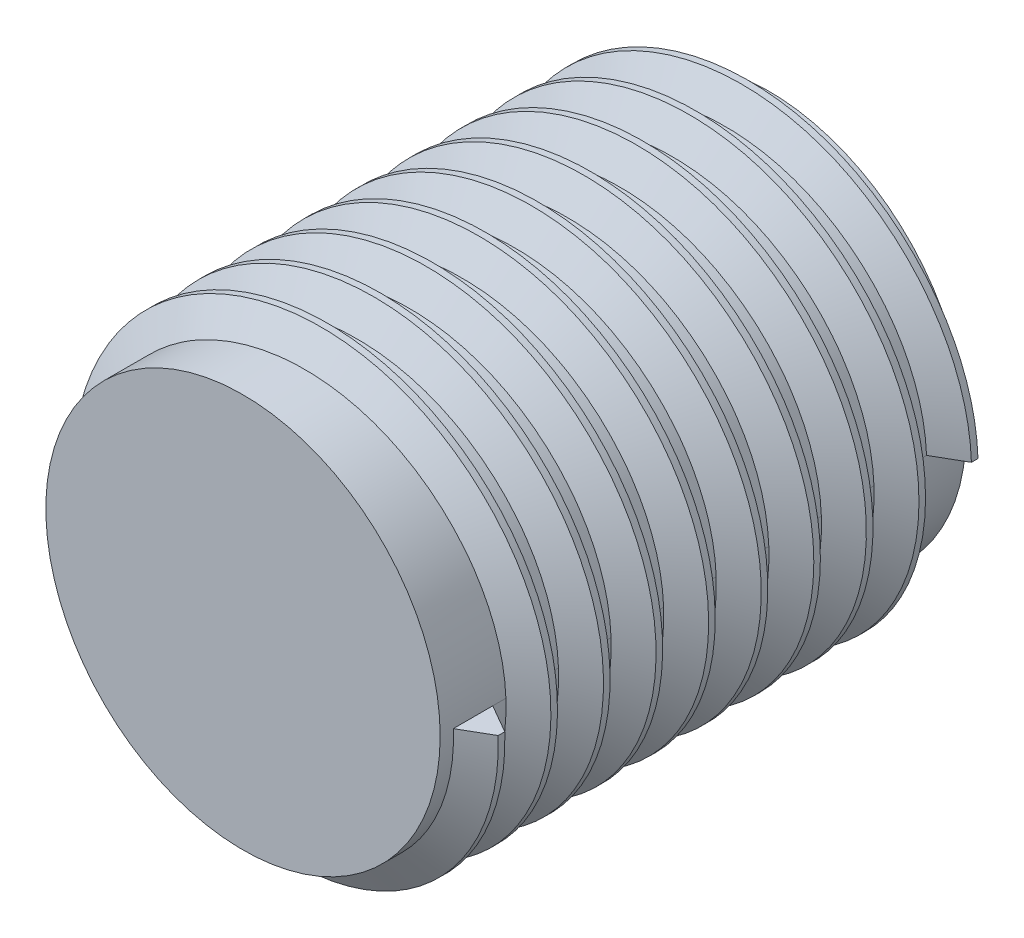
from build123d import *

# Parameters (mm, degrees)
SKETCH1_R           = 2.38125
BOSS_EXTRUDE1_DEPTH = 6.35
THREAD1_PITCH       = 0.635


with BuildPart() as part:
    # Sketch1 → Boss-Extrude1 (new body)
    with BuildSketch(Plane.XY):
        Circle(SKETCH1_R)
    extrude(amount=BOSS_EXTRUDE1_DEPTH)

    # Thread1: the profile of Thread Profile1 profile screwed along a right-hand helix of 9 turns, 6 arcs to a turn; built about Z, then put on its axis
    thread1_z = Axis((0, 0, 0), (0, 0, 1))
    thread1_corners = [(2.38095, 0, -0.000173205), (2.724953831, 0, 0.198437499), (2.724953831, 0, 0.277812499), (2.38095, 0, 0.476423203)]
    with BuildLine(mode=Mode.PRIVATE) as thread1_profile:
        Line(thread1_corners[0], thread1_corners[1])
        Line(thread1_corners[1], thread1_corners[2])
        Line(thread1_corners[2], thread1_corners[3])
        Line(thread1_corners[3], thread1_corners[0])
    thread1_cap = Face(thread1_profile.wire())
    thread1_turn_angles = [0, 30, 60, 90, 120, 150, 180, 210, 240, 270, 300, 330, 360]
    thread1_turn_weights = [1, 0.8660254037844387, 1, 0.8660254037844387, 1, 0.8660254037844387, 1, 0.8660254037844387, 1, 0.8660254037844387, 1, 0.8660254037844387, 1]
    thread1_turn_rails = [Edge.make_bspline([Vector(p[0], p[1], 0).rotate(thread1_z, thread1_turn_angles[k]) / thread1_turn_weights[k] + Vector(0, 0, p[2] + THREAD1_PITCH * thread1_turn_angles[k] / 360) for k in range(13)], [0, 0, 0, 1, 1, 2, 2, 3, 3, 4, 4, 5, 5, 6, 6, 6], 2, thread1_turn_weights) for p in thread1_corners]
    thread1_turn_sides = [Face.make_surface_from_curves(thread1_turn_rails[p[0]], thread1_turn_rails[p[1]]) for p in [(0, 1), (1, 2), (2, 3), (3, 0)]]
    thread1 = Plane(origin=(0, 0, 0), x_dir=(1, 0, 0), z_dir=(0, 0, 1)) * Solid(Shell([*[p.moved(Location((0, 0, THREAD1_PITCH * i))) for i in range(9) for p in thread1_turn_sides], thread1_cap, thread1_cap.rotate(thread1_z, 3240).moved(Location((0, 0, THREAD1_PITCH * 3240 / 360)))]))
    add(thread1)


solid = part.part
